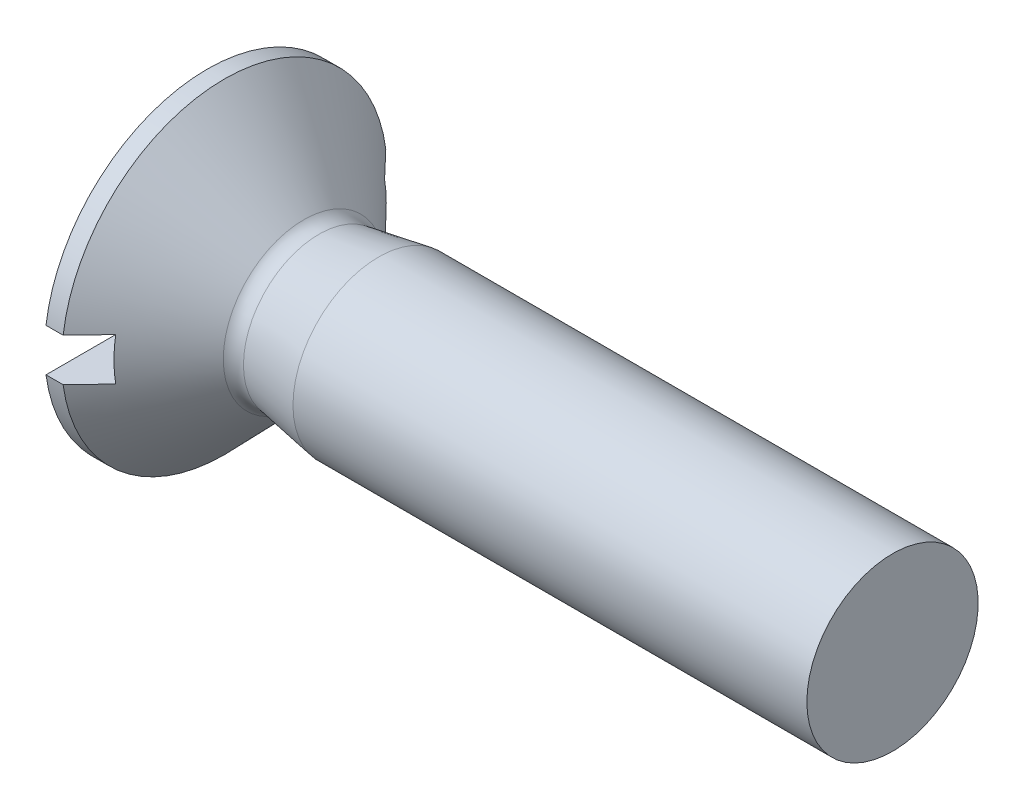
from build123d import *

# Parameters (mm, degrees)
CUT_EXTRUDE_1_DEPTH      = 9.439194274
CUT_EXTRUDE_1_DEPTH_BACK = 9.439194274
SKETCH_3_W               = 0.5
SKETCH_3_H               = 0.5


with BuildPart() as part:
    # Эскиз2 → Повернуть1 (revolve)
    with BuildSketch(Plane.XY):
        with BuildLine():
            Line((0, 0), (0, 1.9))
            Line((0, 1.9), (0.2, 1.9))
            Line((0.2, 1.9), (1.126725855, 0.940347284))
            ThreePointArc((1.126725855, 0.940347284), (1.20815228, 0.889276183), (1.304000388, 0.882088693))
            Line((1.304000388, 0.882088693), (2, 1))
            Line((2, 1), (8, 1))
            Line((8, 1), (8, 0))
            Line((8, 0), (0, 0))
        make_face()
    revolve(axis=Axis((0, 0, 0), (1, 0, 0)))

    # Эскиз3 → Вырез-Вытянуть1 (cut, two sides: drawn at the far end of the back side and taken through both)
    with BuildSketch(Plane.XY.offset(-CUT_EXTRUDE_1_DEPTH_BACK)):
        with Locations((0.25, 0)):
            Rectangle(SKETCH_3_W, SKETCH_3_H)
    extrude(amount=CUT_EXTRUDE_1_DEPTH + CUT_EXTRUDE_1_DEPTH_BACK, mode=Mode.SUBTRACT)


solid = part.part
